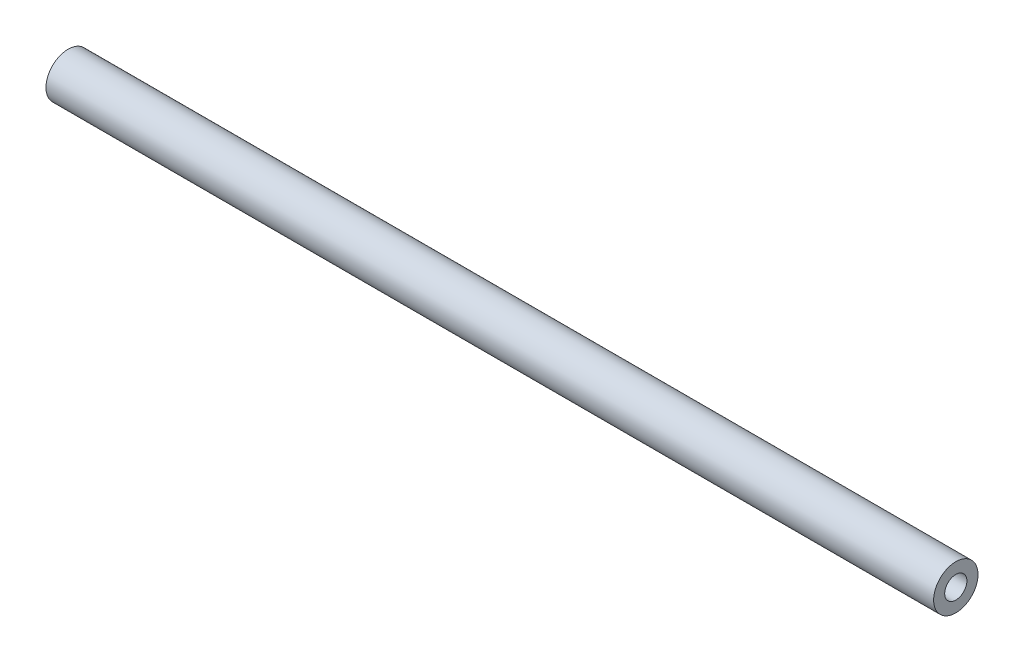
from build123d import *

# Parameters (mm, degrees)
SKETCH1_R           = 12.7
SKETCH1_R_2         = 6.35
BOSS_EXTRUDE1_DEPTH = 508


with BuildPart() as part:
    # Sketch1 → Boss-Extrude1 (new body)
    with BuildSketch(Plane(origin=(0, 0, 0), x_dir=(0, 0, -1), z_dir=(1, 0, 0))):
        Circle(SKETCH1_R)
        Circle(SKETCH1_R_2, mode=Mode.SUBTRACT)
    extrude(amount=BOSS_EXTRUDE1_DEPTH)


solid = part.part
